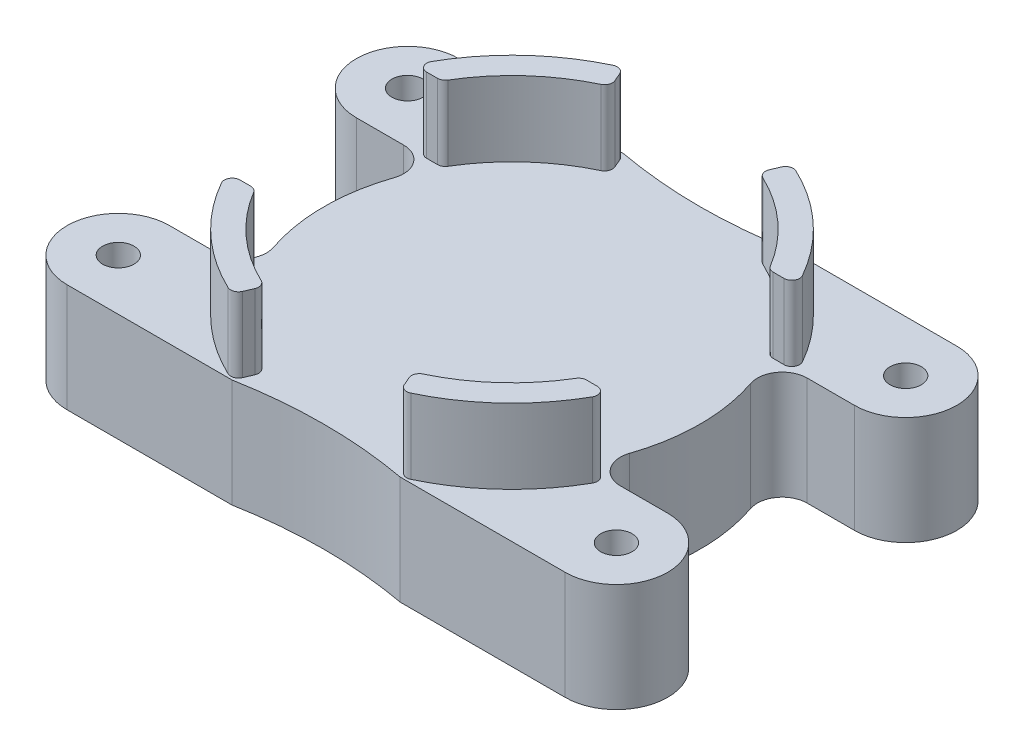
from build123d import *

# Parameters (mm, degrees)
SKETCH1_R           = 1.6
SKETCH1_R_2         = 21.732875
SKETCH1_R_3         = 19.192875
BOSS_EXTRUDE1_DEPTH = 11.05
BOSS_EXTRUDE2_START = 11.05
SKETCH1_3_R         = 21.732875
SKETCH1_3_R_2       = 19.192875
BOSS_EXTRUDE2_DEPTH = 7.62
CUT_EXTRUDE1_DEPTH  = 42.937776077
FILLET2_R           = 0.79375
FILLET4_R           = 2.54
FILLET5_R           = 2.54
FILLET6_R           = 2.54
FILLET7_R           = 2.54
BOSS_EXTRUDE3_DEPTH = 11.05


with BuildPart() as part:
    # Sketch1 → Boss-Extrude1 (new body)
    # profile 1 of 6: a face of its own
    with BuildSketch(Plane(origin=(0, 0, 0), x_dir=(1, 0, 0), z_dir=(0, 1, 0))):
        with BuildLine():
            Line((-8.562572408, 19.9749896), (-25.4, 19.9749896))
            ThreePointArc((-25.4, 19.9749896), (-30.6249948, 14.7499948), (-25.4, 9.525))
            Line((-25.4, 9.525), (-19.534385856, 9.525))
            ThreePointArc((-19.534385856, 9.525), (-14.98867361, 15.737138215), (-8.562572408, 19.9749896))
        make_face()
        with Locations(Location((-25.4, 14.7499948, 0), (0, 0, 270))):
            Circle(SKETCH1_R, mode=Mode.SUBTRACT)
    # profile 2 of 6: a face of its own
    with BuildSketch(Plane(origin=(0, 0, 0), x_dir=(1, 0, 0), z_dir=(0, 1, 0))):
        Circle(SKETCH1_R_2)
        Circle(SKETCH1_R_3, mode=Mode.SUBTRACT)
    # profile 3 of 6: a face of its own
    with BuildSketch(Plane(origin=(0, 0, 0), x_dir=(1, 0, 0), z_dir=(0, 1, 0))):
        with BuildLine():
            Line((25.4, 19.9749896), (8.562572408, 19.9749896))
            ThreePointArc((8.562572408, 19.9749896), (14.98867361, 15.737138215), (19.534385856, 9.525))
            Line((19.534385856, 9.525), (25.4, 9.525))
            ThreePointArc((25.4, 9.525), (30.6249948, 14.7499948), (25.4, 19.9749896))
        make_face()
        with Locations(Location((25.4, 14.7499948, 0), (0, 0, 270))):
            Circle(SKETCH1_R, mode=Mode.SUBTRACT)
    # profile 4 of 6: a face of its own
    with BuildSketch(Plane(origin=(0, 0, 0), x_dir=(1, 0, 0), z_dir=(0, 1, 0))):
        with BuildLine():
            Line((25.4, -9.525), (19.534385856, -9.525))
            ThreePointArc((19.534385856, -9.525), (14.98867361, -15.737138215), (8.562572408, -19.9749896))
            Line((8.562572408, -19.9749896), (25.4, -19.9749896))
            ThreePointArc((25.4, -19.9749896), (30.6249948, -14.7499948), (25.4, -9.525))
        make_face()
        with Locations(Location((25.4, -14.7499948, 0), (0, 0, 270))):
            Circle(SKETCH1_R, mode=Mode.SUBTRACT)
    # profile 5 of 6: a face of its own
    with BuildSketch(Plane(origin=(0, 0, 0), x_dir=(1, 0, 0), z_dir=(0, 1, 0))):
        with BuildLine():
            ThreePointArc((-8.562572408, -19.9749896), (-14.98867361, -15.737138215), (-19.534385856, -9.525))
            Line((-19.534385856, -9.525), (-25.4, -9.525))
            ThreePointArc((-25.4, -9.525), (-30.6249948, -14.7499948), (-25.4, -19.9749896))
            Line((-25.4, -19.9749896), (-8.562572408, -19.9749896))
        make_face()
        with Locations(Location((-25.4, -14.7499948, 0), (0, 0, 270))):
            Circle(SKETCH1_R, mode=Mode.SUBTRACT)
    # profile 6 of 6: a face of its own
    with BuildSketch(Plane(origin=(0, 0, 0), x_dir=(1, 0, 0), z_dir=(0, 1, 0))):
        Circle(SKETCH1_R_3)
    extrude(amount=BOSS_EXTRUDE1_DEPTH)

    # Sketch1<3> → Boss-Extrude2 (add)
    with BuildSketch(Plane(origin=(0, 0, 0), x_dir=(1, 0, 0), z_dir=(0, 1, 0)).offset(BOSS_EXTRUDE2_START)):
        with Locations(Location((0, 0, 0), (0, 0, 113.203103919))):
            Circle(SKETCH1_3_R)
        with Locations(Location((0, 0, 0), (0, 0, 90))):
            Circle(SKETCH1_3_R_2, mode=Mode.SUBTRACT)
    extrude(amount=BOSS_EXTRUDE2_DEPTH)

    # Sketch2 → Cut-Extrude1 (cut, through all)
    with BuildSketch(Plane(origin=(0, 18.67, 0), x_dir=(1, 0, 0), z_dir=(0, 1, 0))):
        with BuildLine():
            Line((-19.534385856, 9.525), (-16.6625576, 9.525))
            ThreePointArc((-16.6625576, 9.525), (-19.192875, 0), (-16.6625576, -9.525))
            Line((-16.6625576, -9.525), (-19.534385856, -9.525))
            ThreePointArc((-19.534385856, -9.525), (-21.732875, 0), (-19.534385856, 9.525))
        make_face()
        with BuildLine():
            Line((19.534385856, 9.525), (16.6625576, 9.525))
            ThreePointArc((16.6625576, 9.525), (19.192875, 0), (16.6625576, -9.525))
            Line((16.6625576, -9.525), (19.534385856, -9.525))
            ThreePointArc((19.534385856, -9.525), (21.732875, 0), (19.534385856, 9.525))
        make_face()
        with BuildLine():
            Line((-8.562572408, 19.9749896), (-7.561833485, 17.640440049))
            ThreePointArc((-7.561833485, 17.640440049), (0, 19.192875), (7.561833485, 17.640440049))
            Line((7.561833485, 17.640440049), (8.562572408, 19.9749896))
            ThreePointArc((8.562572408, 19.9749896), (0, 21.732875), (-8.562572408, 19.9749896))
        make_face()
        with BuildLine():
            Line((-8.562572408, -19.9749896), (-7.561833485, -17.640440049))
            ThreePointArc((-7.561833485, -17.640440049), (0, -19.192875), (7.561833485, -17.640440049))
            Line((7.561833485, -17.640440049), (8.562572408, -19.9749896))
            ThreePointArc((8.562572408, -19.9749896), (0, -21.732875), (-8.562572408, -19.9749896))
        make_face()
    extrude(amount=-CUT_EXTRUDE1_DEPTH, mode=Mode.SUBTRACT)

    # Fillet2
    fillet2_edges = [part.edges().sort_by_distance(p)[0] for p in [
        (16.6625576, 14.86, 9.525),
        (19.534385856, 14.86, -9.525),
        (19.534385856, 14.86, 9.525),
        (16.6625576, 14.86, -9.525),
        (7.561833485, 14.86, -17.640440049),
        (-8.562572408, 14.86, -19.9749896),
        (8.562572408, 14.86, -19.9749896),
        (-7.561833485, 14.86, -17.640440049),
        (-16.6625576, 14.86, -9.525),
        (-19.534385856, 14.86, 9.525),
        (-19.534385856, 14.86, -9.525),
        (-16.6625576, 14.86, 9.525),
        (-7.561833485, 14.86, 17.640440049),
        (8.562572408, 14.86, 19.9749896),
        (-8.562572408, 14.86, 19.9749896),
        (7.561833485, 14.86, 17.640440049),
    ]]
    fillet(fillet2_edges, radius=FILLET2_R)

    # Fillet4
    # the kernel refuses this fillet: 2.54 mm, written as the material it adds along each edge
    with BuildSketch(Plane(origin=(16.6625576, 11.05, 9.525), x_dir=(1, 0, 0), z_dir=(0, -1, 0))) as fillet4_piece_1:
        with BuildLine():
            CenterArc((3.917229347, -2.54), FILLET4_R, 90, 108.747762366)
            ThreePointArc((1.511994934, -3.356362308), (0.836652457, -1.641847194), (0, 0))
            Line((0, 0), (3.917229347, 0))
        make_face()
    extrude(amount=11.05)

    # Fillet5
    # the kernel refuses this fillet: 2.54 mm, written as the material it adds along each edge
    with BuildSketch(Plane(origin=(16.6625576, 11.05, -9.525), x_dir=(0.41073329589504654, 0, 0.9117555372155368), z_dir=(0, -1, 0))) as fillet5_piece_1:
        with BuildLine():
            CenterArc((3.924795585, -2.528292976), FILLET5_R, 95.503145264, 108.747762366)
            Line((1.60893652, -3.571555547), (0, 0))
            ThreePointArc((0, 0), (1.840604291, -0.088461201), (3.681208582, 0))
        make_face()
    extrude(amount=11.05)

    # Fillet6
    # the kernel refuses this fillet: 2.54 mm, written as the material it adds along each edge
    with BuildSketch(Plane(origin=(-16.6625576, 11.05, -9.525), x_dir=(-1, 0, 0), z_dir=(0, -1, 0))) as fillet6_piece_1:
        with BuildLine():
            CenterArc((3.917229347, -2.54), FILLET6_R, 90, 108.747762366)
            ThreePointArc((1.511994934, -3.356362308), (0.836652457, -1.641847194), (0, 0))
            Line((0, 0), (3.917229347, 0))
        make_face()
    extrude(amount=11.05)

    # Fillet7
    # the kernel refuses this fillet: 2.54 mm, written as the material it adds along each edge
    with BuildSketch(Plane(origin=(-16.6625576, 11.05, 9.525), x_dir=(-0.41073329589504604, 0, -0.9117555372155371), z_dir=(0, -1, 0))) as fillet7_piece_1:
        with BuildLine():
            CenterArc((3.924795585, -2.528292976), FILLET7_R, 95.503145264, 108.747762366)
            Line((1.60893652, -3.571555547), (0, 0))
            ThreePointArc((0, 0), (1.840604291, -0.088461201), (3.681208582, 0))
        make_face()
    extrude(amount=11.05)

    # Sketch3 → Boss-Extrude3 (add)
    with BuildSketch(Plane(origin=(0, 11.05, 0), x_dir=(1, 0, 0), z_dir=(0, 1, 0))):
        with BuildLine():
            ThreePointArc((9.7e-08, 19.192875), (3.859772707, 18.800760767), (7.561833485, 17.640440049))
            Line((7.561833485, 17.640440049), (8.562572408, 19.9749896))
            ThreePointArc((8.562572408, 19.9749896), (4.299108953, 19.388809795), (9.7e-08, 19.192875))
        make_face()
        with BuildLine():
            ThreePointArc((-7.561833485, 17.640440049), (-3.859772612, 18.800760786), (9.7e-08, 19.192875))
            ThreePointArc((9.7e-08, 19.192875), (-4.299108856, 19.388809786), (-8.562572408, 19.9749896))
            Line((-8.562572408, 19.9749896), (-7.561833485, 17.640440049))
        make_face()
        with BuildLine():
            ThreePointArc((7.561833485, -17.640440049), (3.859772707, -18.800760767), (9.7e-08, -19.192875))
            ThreePointArc((9.7e-08, -19.192875), (4.299108953, -19.388809795), (8.562572408, -19.9749896))
            Line((8.562572408, -19.9749896), (7.561833485, -17.640440049))
        make_face()
        with BuildLine():
            Line((-7.561833485, -17.640440049), (-8.562572408, -19.9749896))
            ThreePointArc((-8.562572408, -19.9749896), (-4.299108856, -19.388809786), (9.7e-08, -19.192875))
            ThreePointArc((9.7e-08, -19.192875), (-3.859772612, -18.800760786), (-7.561833485, -17.640440049))
        make_face()
    extrude(amount=-BOSS_EXTRUDE3_DEPTH)


solid = part.part
